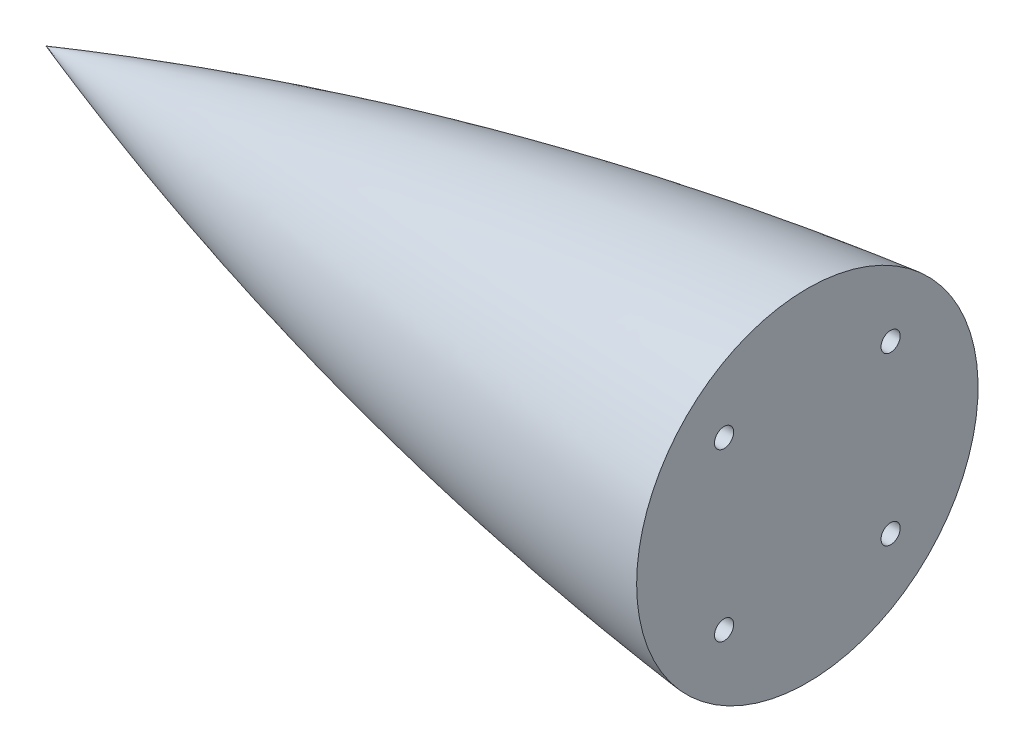
from build123d import *

# Parameters (mm, degrees)
F_1_4_20_TAPPED_HOLE1_D     = 5.1054
F_1_4_20_TAPPED_HOLE1_DEPTH = 50.8
F_1_4_20_TAPPED_HOLE1_TIP   = 1.533816902


with BuildPart() as part:
    # Sketch1 → Revolve1 (revolve)
    with BuildSketch(Plane.XY):
        with BuildLine():
            Line((0, 0), (203.2, 0))
            Line((203.2, 0), (203.2, 45.5653204))
            add(Edge.make_bspline(
                [(0, 0), (29.028571441, 10.015809334), (58.057142877, 18.786268451), (87.08571431, 26.370670948), (116.114285738, 32.812581284), (145.142857162, 38.144693155), (174.171428583, 42.390470762), (203.2, 45.5653204)],
                knots=[0.080753037, 0.080753037, 0.080753037, 0.080753037, 0.080753037, 0.080753037, 0.080753037, 0.080753037, 0.916432094, 0.916432094, 0.916432094, 0.916432094, 0.916432094, 0.916432094, 0.916432094, 0.916432094], degree=7))
        make_face()
    revolve(axis=Axis((0, 0, 0), (1, 0, 0)))

    # 1/4-20 Tapped Hole1
    with Locations(Plane(origin=(203.2, 0, 0), x_dir=(0, 0, -1), z_dir=(1, 0, 0))):
        with Locations((-22.225, 22.225), (22.225, 22.225), (22.225, -22.225), (-22.225, -22.225)):
            Hole(F_1_4_20_TAPPED_HOLE1_D / 2, depth=F_1_4_20_TAPPED_HOLE1_DEPTH)
            with Locations((0, 0, -(F_1_4_20_TAPPED_HOLE1_DEPTH + F_1_4_20_TAPPED_HOLE1_TIP / 2))):  # 118° drill point
                Cone(0, F_1_4_20_TAPPED_HOLE1_D / 2, F_1_4_20_TAPPED_HOLE1_TIP, mode=Mode.SUBTRACT)


solid = part.part
